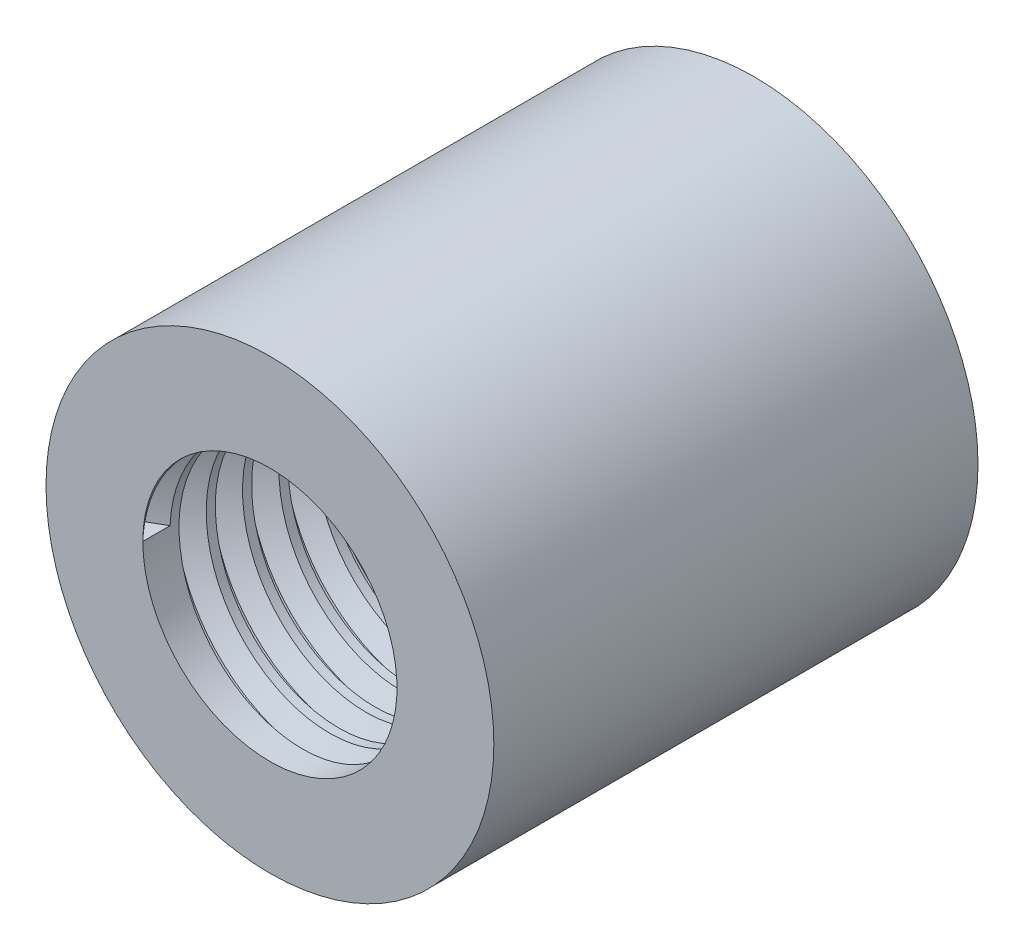
from build123d import *

# Parameters (mm, degrees)
SKETCH1_R           = 9.25
SKETCH1_R_2         = 5.25
BOSS_EXTRUDE1_DEPTH = 20
SKETCH4_R           = 6
CUT_EXTRUDE1_DEPTH  = 12
THREAD1_PITCH       = 1.5
SKETCH11_R          = 4
CUT_EXTRUDE2_DEPTH  = 12


with BuildPart() as part:
    # Sketch1 → Boss-Extrude1 (new body)
    with BuildSketch(Plane.XY):
        Circle(SKETCH1_R)
        Circle(SKETCH1_R_2, mode=Mode.SUBTRACT)
    extrude(amount=BOSS_EXTRUDE1_DEPTH)

    # Sketch4 → Cut-Extrude1 (cut)
    with BuildSketch(Plane(origin=(0, 0, 0), x_dir=(-1, 0, 0), z_dir=(0, 0, -1))):
        Circle(SKETCH4_R)
    extrude(amount=-CUT_EXTRUDE1_DEPTH, mode=Mode.SUBTRACT)

    # Thread1: the profile of Thread Profile2 profile screwed along a right-hand helix of 5.333333 turns, 8 arcs to a turn; built about Z, then put on its axis
    thread1_z = Axis((0, 0, 0), (0, 0, 1))
    thread1_corners = [(5.2497, 0, -0.000173205), (6.061898812, 0, 0.468749998), (6.061898812, 0, 0.656249998), (5.2497, 0, 1.125173201)]
    with BuildLine(mode=Mode.PRIVATE) as thread1_profile:
        Line(thread1_corners[0], thread1_corners[1])
        Line(thread1_corners[1], thread1_corners[2])
        Line(thread1_corners[2], thread1_corners[3])
        Line(thread1_corners[3], thread1_corners[0])
    thread1_cap = Face(thread1_profile.wire())
    thread1_turn_angles = [0, 22.5, 45, 67.5, 90, 112.5, 135, 157.5, 180, 202.5, 225, 247.5, 270, 292.5, 315, 337.5, 360]
    thread1_turn_weights = [1, 0.9238795325112867, 1, 0.9238795325112867, 1, 0.9238795325112867, 1, 0.9238795325112867, 1, 0.9238795325112867, 1, 0.9238795325112867, 1, 0.9238795325112867, 1, 0.9238795325112867, 1]
    thread1_turn_rails = [Edge.make_bspline([Vector(p[0], p[1], 0).rotate(thread1_z, thread1_turn_angles[k]) / thread1_turn_weights[k] + Vector(0, 0, p[2] + THREAD1_PITCH * thread1_turn_angles[k] / 360) for k in range(17)], [0, 0, 0, 1, 1, 2, 2, 3, 3, 4, 4, 5, 5, 6, 6, 7, 7, 8, 8, 8], 2, thread1_turn_weights) for p in thread1_corners]
    thread1_turn_sides = [Face.make_surface_from_curves(thread1_turn_rails[p[0]], thread1_turn_rails[p[1]]) for p in [(0, 1), (1, 2), (2, 3), (3, 0)]]
    thread1_last_angles = [1800, 1822.5, 1845, 1867.5, 1890, 1905, 1920]
    thread1_last_weights = [1, 0.9238795325112867, 1, 0.9238795325112867, 1, 0.9659258262890688, 1]
    thread1_last_rails = [Edge.make_bspline([Vector(p[0], p[1], 0).rotate(thread1_z, thread1_last_angles[k]) / thread1_last_weights[k] + Vector(0, 0, p[2] + THREAD1_PITCH * thread1_last_angles[k] / 360) for k in range(7)], [0, 0, 0, 1, 1, 2, 2, 3, 3, 3], 2, thread1_last_weights) for p in thread1_corners]
    thread1_last_sides = [Face.make_surface_from_curves(thread1_last_rails[p[0]], thread1_last_rails[p[1]]) for p in [(0, 1), (1, 2), (2, 3), (3, 0)]]
    thread1 = Plane(origin=(0, 0, 20), x_dir=(-1, 0, 0), z_dir=(0, 0, -1)) * Solid(Shell([*[p.moved(Location((0, 0, THREAD1_PITCH * i))) for i in range(5) for p in thread1_turn_sides], *thread1_last_sides, thread1_cap, thread1_cap.rotate(thread1_z, 1920).moved(Location((0, 0, THREAD1_PITCH * 1920 / 360)))]))
    add(thread1, mode=Mode.SUBTRACT)

    # Sketch11 → Cut-Extrude2 (cut)
    with BuildSketch(Plane(origin=(0, 0, 0), x_dir=(1, 0, 0), z_dir=(0, 1, 0))):
        with Locations(Location((0, -6, 0), (0, 0, 270))):
            Circle(SKETCH11_R)
    extrude(amount=-CUT_EXTRUDE2_DEPTH, mode=Mode.SUBTRACT)


solid = part.part
